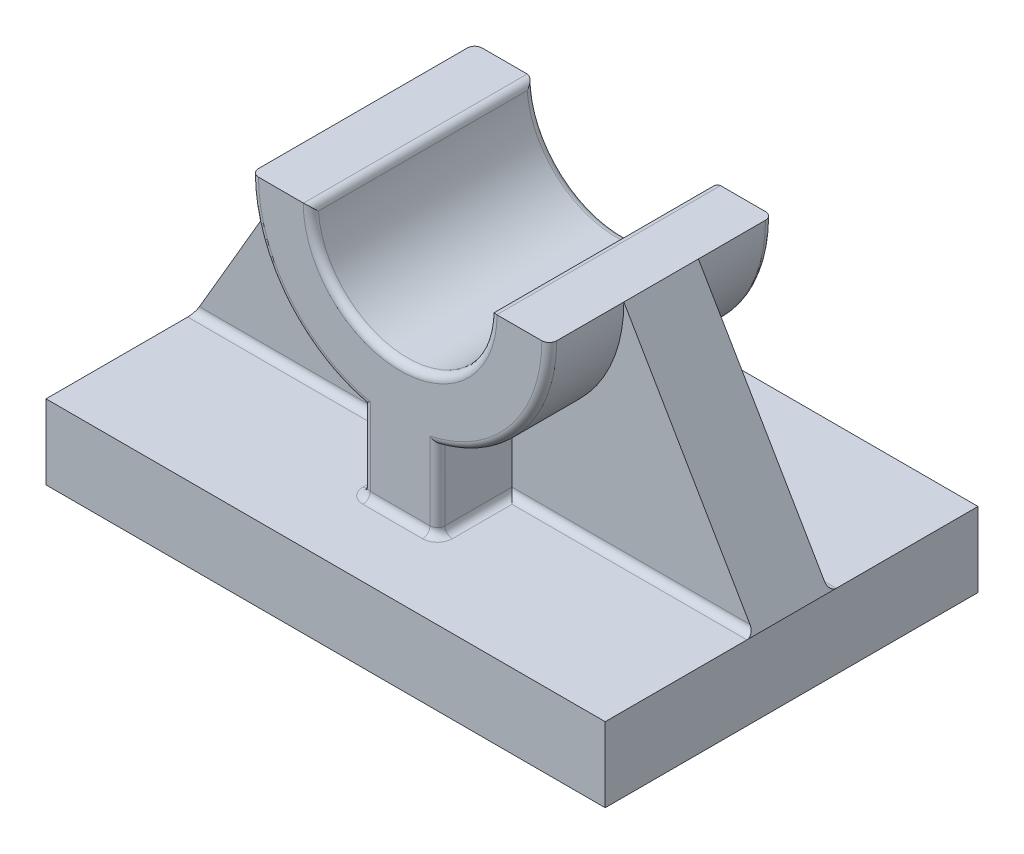
from build123d import *

# Parameters (mm, degrees)
SKETCH1_W           = 75
SKETCH1_H           = 10
BOSS_EXTRUDE5_DEPTH = 25
BOSS_EXTRUDE6_DEPTH = 15
BOSS_EXTRUDE7_DEPTH = 5
FILLET2_R           = 1
FILLET3_R           = 1


with BuildPart() as part:
    # Sketch1 → Boss-Extrude5 (new, symmetric)
    with BuildSketch(Plane.XY):
        with Locations((0, 5)):
            Rectangle(SKETCH1_W, SKETCH1_H)
    extrude(amount=BOSS_EXTRUDE5_DEPTH, both=True)

    # Sketch1<9> → Boss-Extrude6 (add, symmetric)
    with BuildSketch(Plane.XY):
        with BuildLine():
            Line((-5, 20.635083269), (-5, 10))
            Line((-5, 10), (5, 10))
            Line((5, 10), (5, 20.635083269))
            ThreePointArc((5, 20.635083269), (15.811388301, 27.752551286), (20, 40))
            Line((20, 40), (12, 40))
            ThreePointArc((12, 40), (0, 28), (-12, 40))
            Line((-12, 40), (-20, 40))
            ThreePointArc((-20, 40), (-15.811388301, 27.752551286), (-5, 20.635083269))
        make_face()
    extrude(amount=BOSS_EXTRUDE6_DEPTH, both=True)

    # Sketch1<10> → Boss-Extrude7 (add, symmetric)
    with BuildSketch(Plane.XY):
        with BuildLine():
            Line((5, 10), (37.5, 10))
            Line((37.5, 10), (20, 40))
            ThreePointArc((20, 40), (15.811388301, 27.752551286), (5, 20.635083269))
            Line((5, 20.635083269), (5, 10))
        make_face()
        with BuildLine():
            Line((-20, 40), (-37.5, 10))
            Line((-37.5, 10), (-5, 10))
            Line((-5, 10), (-5, 20.635083269))
            ThreePointArc((-5, 20.635083269), (-15.811388301, 27.752551286), (-20, 40))
        make_face()
    extrude(amount=BOSS_EXTRUDE7_DEPTH, both=True)

    # Fillet2
    fillet2_edges = [part.edges().sort_by_distance(p)[0] for p in [
        (-12, 40, 0),
        (-15.811388301, 27.752551286, -15),
        (-5, 15.317541634, -15),
        (5, 15.317541634, 15),
        (15.811388301, 27.752551286, -15),
        (0, 28, 15),
        (12, 40, 0),
        (-15.811388301, 27.752551286, 15),
        (-5, 15.317541634, 15),
        (15.811388301, 27.752551286, 15),
        (0, 28, -15),
        (5, 15.317541634, -15),
    ]]
    fillet(fillet2_edges, radius=FILLET2_R)

    # Fillet3
    # the kernel refuses this fillet: 1 mm, written as the material it adds along each edge
    with BuildSketch(Plane(origin=(5, 10, -14), x_dir=(1, 0, 0), z_dir=(0, 0, 1)), Plane(origin=(5, 10, 2.5), x_dir=(1, 0, 0), z_dir=(0, 0, 1))) as fillet3_piece_1:
        with BuildLine():
            CenterArc((FILLET3_R, FILLET3_R), FILLET3_R, 180, 90)
            Line((0, FILLET3_R), (0, 0))
            Line((0, 0), (FILLET3_R, 0))
        make_face()
    extrude(amount=11.5)
    with BuildSketch(Plane(origin=(-5, 10, -14), x_dir=(-1, 0, 0), z_dir=(0, 0, 1)), Plane(origin=(-5, 10, 2.5), x_dir=(-1, 0, 0), z_dir=(0, 0, 1))) as fillet3_piece_2:
        with BuildLine():
            CenterArc((FILLET3_R, -FILLET3_R), FILLET3_R, 90, 90)
            Line((0, -FILLET3_R), (0, 0))
            Line((0, 0), (FILLET3_R, 0))
        make_face()
    extrude(amount=11.5)
    with BuildSketch(Plane(origin=(2.5, 10, 5), x_dir=(0, 0, 1), z_dir=(1, 0, 0))) as fillet3_piece_3_section:
        with BuildLine():
            CenterArc((FILLET3_R, -FILLET3_R), FILLET3_R, 90, 90)
            Line((0, -FILLET3_R), (0, 0))
            Line((0, 0), (FILLET3_R, 0))
        make_face()
    fillet3_piece_3 = extrude(amount=35, mode=Mode.PRIVATE)
    fillet3_piece_3 = split(fillet3_piece_3, bisect_by=Plane(origin=(28.832812489, 24.858035733, 5.226395114), z_dir=(-0.8637789008984333, -0.5038710255240864, 0)), keep=Keep.TOP, mode=Mode.PRIVATE)
    add(fillet3_piece_3)
    with BuildSketch(Plane(origin=(2.5, 10, -5), x_dir=(0, 0, -1), z_dir=(1, 0, 0))) as fillet3_piece_4_section:
        with BuildLine():
            CenterArc((FILLET3_R, FILLET3_R), FILLET3_R, 180, 90)
            Line((0, FILLET3_R), (0, 0))
            Line((0, 0), (FILLET3_R, 0))
        make_face()
    fillet3_piece_4 = extrude(amount=35, mode=Mode.PRIVATE)
    fillet3_piece_4 = split(fillet3_piece_4, bisect_by=Plane(origin=(28.832812489, 24.858035733, -5.226395114), z_dir=(-0.8637789008984333, -0.5038710255240864, 0)), keep=Keep.TOP, mode=Mode.PRIVATE)
    add(fillet3_piece_4)
    with BuildSketch(Plane(origin=(-37.5, 10, 5), x_dir=(0, 0, 1), z_dir=(1, 0, 0))) as fillet3_piece_5_section:
        with BuildLine():
            CenterArc((FILLET3_R, -FILLET3_R), FILLET3_R, 90, 90)
            Line((0, -FILLET3_R), (0, 0))
            Line((0, 0), (FILLET3_R, 0))
        make_face()
    fillet3_piece_5 = extrude(amount=35, mode=Mode.PRIVATE)
    fillet3_piece_5 = split(fillet3_piece_5, bisect_by=Plane(origin=(-33.259418432, 17.269568402, 5.226886144), z_dir=(0.8637789008984326, -0.5038710255240878, 0)), keep=Keep.TOP, mode=Mode.PRIVATE)
    add(fillet3_piece_5)
    with BuildSketch(Plane(origin=(-37.5, 10, -5), x_dir=(0, 0, -1), z_dir=(1, 0, 0))) as fillet3_piece_6_section:
        with BuildLine():
            CenterArc((FILLET3_R, FILLET3_R), FILLET3_R, 180, 90)
            Line((0, FILLET3_R), (0, 0))
            Line((0, 0), (FILLET3_R, 0))
        make_face()
    fillet3_piece_6 = extrude(amount=35, mode=Mode.PRIVATE)
    fillet3_piece_6 = split(fillet3_piece_6, bisect_by=Plane(origin=(-33.259418432, 17.269568402, -5.226886144), z_dir=(0.8637789008984326, -0.5038710255240878, 0)), keep=Keep.TOP, mode=Mode.PRIVATE)
    add(fillet3_piece_6)
    with BuildSketch(Plane(origin=(-4, 10, 15), x_dir=(0, 0, 1), z_dir=(1, 0, 0))) as fillet3_piece_7:
        with BuildLine():
            CenterArc((FILLET3_R, -FILLET3_R), FILLET3_R, 90, 90)
            Line((0, -FILLET3_R), (0, 0))
            Line((0, 0), (FILLET3_R, 0))
        make_face()
    extrude(amount=8)
    with BuildSketch(Plane(origin=(-4, 10, -15), x_dir=(0, 0, -1), z_dir=(1, 0, 0))) as fillet3_piece_8:
        with BuildLine():
            CenterArc((FILLET3_R, FILLET3_R), FILLET3_R, 180, 90)
            Line((0, FILLET3_R), (0, 0))
            Line((0, 0), (FILLET3_R, 0))
        make_face()
    extrude(amount=8)
    with BuildSketch(Plane(origin=(-4, 10, 14), x_dir=(0, 0, 1), z_dir=(1, 0, 0))) as fillet3_piece_9:
        with BuildLine():
            CenterArc((1 + FILLET3_R, -FILLET3_R), FILLET3_R, 90, 90)
            Line((1, -FILLET3_R), (1, 0))
            Line((1, 0), (1 + FILLET3_R, 0))
        make_face()
    revolve(axis=Axis((-4, 10, 14), (0, -1, 0)), revolution_arc=90)
    with BuildSketch(Plane(origin=(4, 10, 14), x_dir=(1, 0, 0), z_dir=(0, 0, -1))) as fillet3_piece_10:
        with BuildLine():
            CenterArc((1 + FILLET3_R, -FILLET3_R), FILLET3_R, 90, 90)
            Line((1, -FILLET3_R), (1, 0))
            Line((1, 0), (1 + FILLET3_R, 0))
        make_face()
    revolve(axis=Axis((4, 10, 14), (0, -1, 0)), revolution_arc=90)
    with BuildSketch(Plane(origin=(4, 10, -14), x_dir=(0, 0, -1), z_dir=(-1, 0, 0))) as fillet3_piece_11:
        with BuildLine():
            CenterArc((1 + FILLET3_R, -FILLET3_R), FILLET3_R, 90, 90)
            Line((1, -FILLET3_R), (1, 0))
            Line((1, 0), (1 + FILLET3_R, 0))
        make_face()
    revolve(axis=Axis((4, 10, -14), (0, -1, 0)), revolution_arc=90)
    with BuildSketch(Plane(origin=(-4, 10, -14), x_dir=(-1, 0, 0), z_dir=(0, 0, 1))) as fillet3_piece_12:
        with BuildLine():
            CenterArc((1 + FILLET3_R, -FILLET3_R), FILLET3_R, 90, 90)
            Line((1, -FILLET3_R), (1, 0))
            Line((1, 0), (1 + FILLET3_R, 0))
        make_face()
    revolve(axis=Axis((-4, 10, -14), (0, -1, 0)), revolution_arc=90)


solid = part.part
